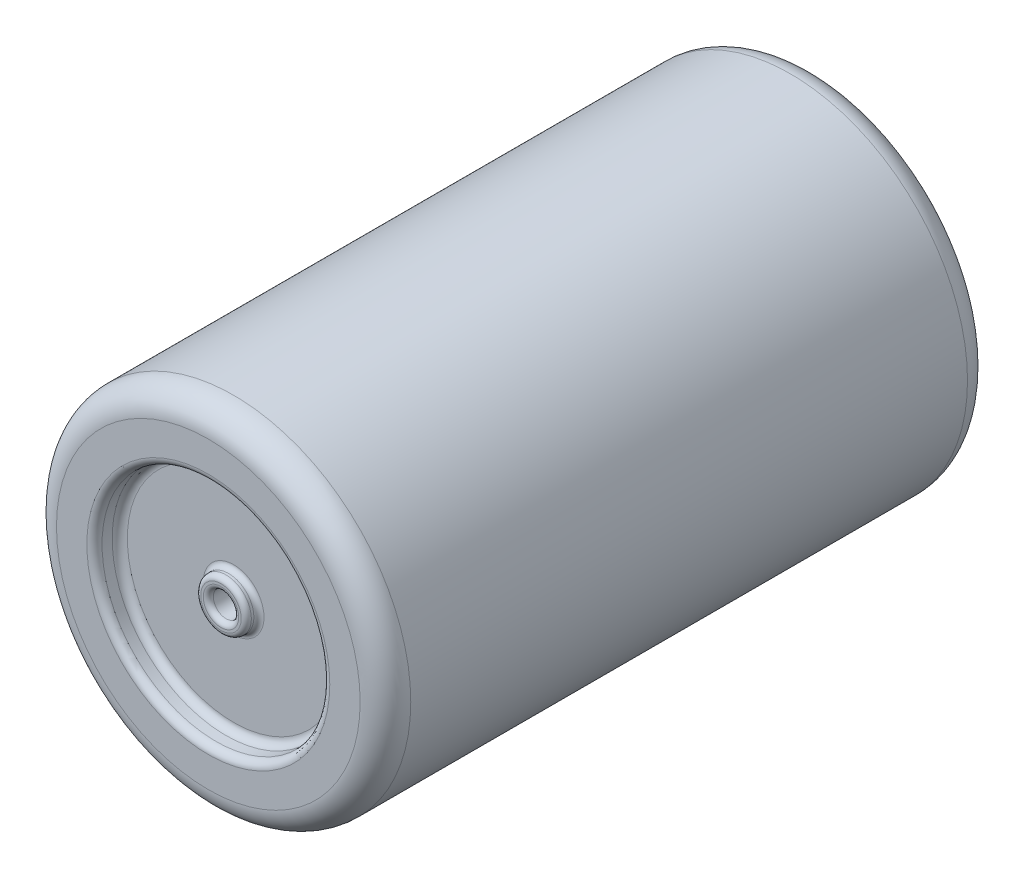
from build123d import *

# Parameters (mm, degrees)
SKETCH1_R           = 3.5
BOSS_EXTRUDE1_DEPTH = 6
FILLET1_R           = 0.5
SKETCH2_R           = 2.25
CUT_EXTRUDE1_DEPTH  = 0.5
SKETCH3_R           = 0.5
BOSS_EXTRUDE2_DEPTH = 0.25
SKETCH4_R           = 0.25
CUT_EXTRUDE2_DEPTH  = 0.5
FILLET2_R           = 0.15
FILLET3_R           = 0.1


# Read off the part's stored shape, not the designer's step: Mirror1
with BuildPart() as part:
    # Sketch1 → Boss-Extrude1 (new, symmetric)
    with BuildSketch(Plane.XY):
        Circle(SKETCH1_R)
    extrude(amount=BOSS_EXTRUDE1_DEPTH, both=True)

    # Fillet1
    fillet1_edges = [part.edges().sort_by_distance(p)[0] for p in [
        (-3.5, 0, -6),
        (-3.5, 0, 6),
    ]]
    fillet(fillet1_edges, radius=FILLET1_R)

    # Sketch2 → Cut-Extrude1 (cut)
    with BuildSketch(Plane.XY.offset(6)):
        Circle(SKETCH2_R)
    extrude(amount=-CUT_EXTRUDE1_DEPTH, mode=Mode.SUBTRACT)

    # Sketch3 → Boss-Extrude2 (add, symmetric)
    with BuildSketch(Plane.XY.offset(5.5)):
        Circle(SKETCH3_R)
    extrude(amount=BOSS_EXTRUDE2_DEPTH, both=True)

    # Sketch4 → Cut-Extrude2 (cut)
    with BuildSketch(Plane.XY.offset(5.75)):
        Circle(SKETCH4_R)
    extrude(amount=-CUT_EXTRUDE2_DEPTH, mode=Mode.SUBTRACT)

    # Fillet2
    fillet2_edges = [part.edges().sort_by_distance(p)[0] for p in [
        (-2.25, 0, 5.5),
        (-2.25, 0, 6),
    ]]
    fillet(fillet2_edges, radius=FILLET2_R)

    # Fillet3
    fillet3_edges = [part.edges().sort_by_distance(p)[0] for p in [
        (-0.5, 0, 5.5),
        (-0.5, 0, 5.75),
        (-0.25, 0, 5.25),
        (-0.25, 0, 5.75),
    ]]
    fillet(fillet3_edges, radius=FILLET3_R)

    # Mirror1 outline → Mirror1 (revolve, cut)
    with BuildSketch(Plane.XZ):
        with BuildLine():
            Line((2.25, -6), (2.25, -5.65))
            ThreePointArc((2.25, -5.65), (2.206066017, -5.543933983), (2.1, -5.5))
            Line((2.1, -5.5), (0.6, -5.5))
            ThreePointArc((0.6, -5.5), (0.529289322, -5.529289322), (0.5, -5.6))
            Line((0.5, -5.6), (0.5, -5.65))
            ThreePointArc((0.5, -5.65), (0.470710678, -5.720710678), (0.4, -5.75))
            Line((0.4, -5.75), (0.35, -5.75))
            ThreePointArc((0.35, -5.75), (0.279289322, -5.720710678), (0.25, -5.65))
            Line((0.25, -5.65), (0.25, -5.35))
            ThreePointArc((0.25, -5.35), (0.220710678, -5.279289322), (0.15, -5.25))
            Line((0.15, -5.25), (0, -5.25))
            Line((0, -5.25), (0, -6))
            Line((0, -6), (2.25, -6))
        make_face()
    revolve(axis=Axis((0, 0, 0), (0, 0, 1)), mode=Mode.SUBTRACT)


solid = part.part
